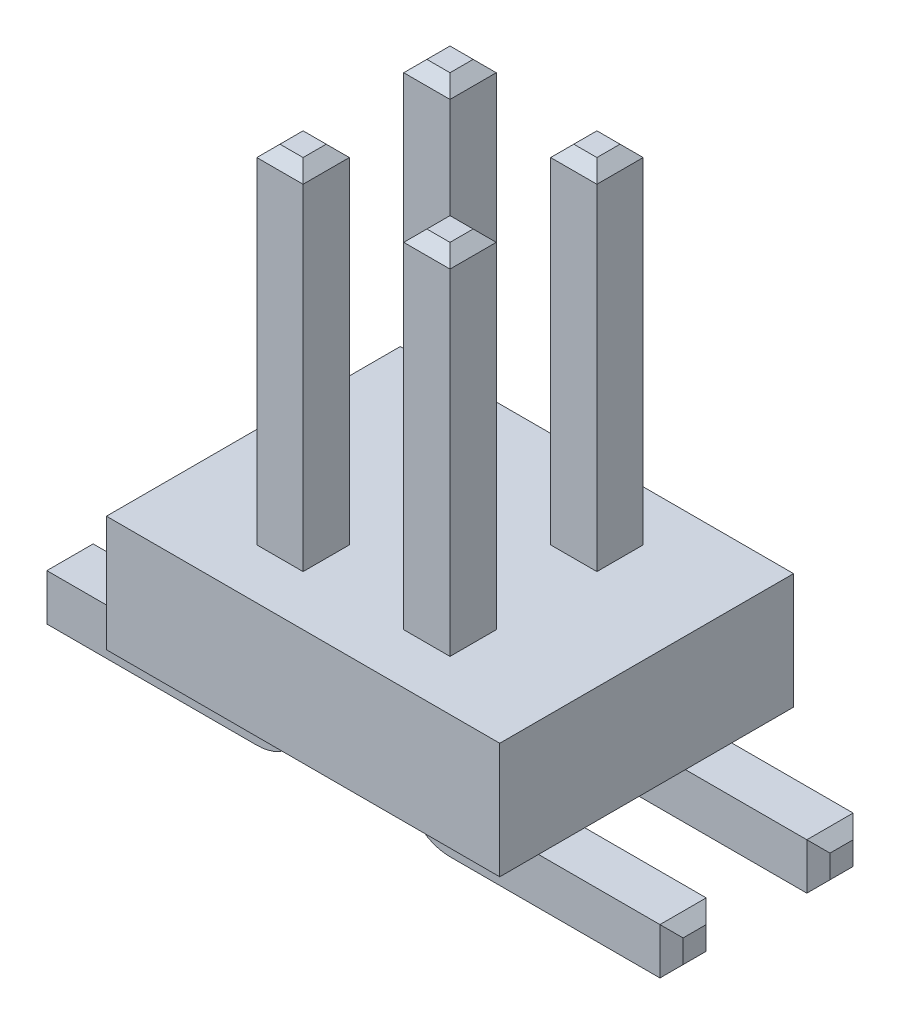
from build123d import *

# Parameters (mm, degrees)
SKIZZE1_W                       = 3.4
SKIZZE1_H                       = 1
AUFSATZ_LINEAR_AUSTRAGEN1_DEPTH = 2.54
SKIZZE3_W                       = 0.4
SKIZZE3_H                       = 0.4
AUFSATZ_LINEAR_AUSTRAGEN3_DEPTH = 0.5
SKIZZE4_W                       = 0.4
SKIZZE4_H                       = 0.4
AUFSATZ_LINEAR_AUSTRAGEN4_DEPTH = 1.915
SKIZZE5_W                       = 0.4
SKIZZE5_H                       = 0.4
AUFSATZ_LINEAR_AUSTRAGEN5_DEPTH = 1.915
SKIZZE6_W                       = 0.4
SKIZZE6_H                       = 0.4
AUFSATZ_LINEAR_AUSTRAGEN6_DEPTH = 3
FASE2_SIZE                      = 0.1
VERRUNDUNG1_R                   = 0.1
VERRUNDUNG2_R                   = 0.4


with BuildPart() as part:
    # Skizze1 → Aufsatz-Linear austragen1 (new body)
    with BuildSketch(Plane.XY):
        with Locations((1.7, 0.5)):
            Rectangle(SKIZZE1_W, SKIZZE1_H)
    extrude(amount=AUFSATZ_LINEAR_AUSTRAGEN1_DEPTH)

    # Skizze3 → Aufsatz-Linear austragen3 (add)
    with BuildSketch(Plane.XZ):
        with Locations((1.065, 1.905)):
            Rectangle(SKIZZE3_W, SKIZZE3_H)
        with Locations((2.335, 1.905)):
            Rectangle(SKIZZE3_W, SKIZZE3_H)
        with Locations((1.065, 0.635)):
            Rectangle(SKIZZE3_W, SKIZZE3_H)
        with Locations((2.335, 0.635)):
            Rectangle(SKIZZE3_W, SKIZZE3_H)
    extrude(amount=AUFSATZ_LINEAR_AUSTRAGEN3_DEPTH)

    # Skizze4 → Aufsatz-Linear austragen4 (add)
    with BuildSketch(Plane(origin=(2.535, 0, 0), x_dir=(0, 0, -1), z_dir=(1, 0, 0))):
        with Locations((-1.905, -0.3)):
            Rectangle(SKIZZE4_W, SKIZZE4_H)
        with Locations((-0.635, -0.3)):
            Rectangle(SKIZZE4_W, SKIZZE4_H)
    extrude(amount=AUFSATZ_LINEAR_AUSTRAGEN4_DEPTH)

    # Skizze5 → Aufsatz-Linear austragen5 (add)
    with BuildSketch(Plane.ZY.offset(-0.865)):
        with Locations((1.905, -0.3)):
            Rectangle(SKIZZE5_W, SKIZZE5_H)
        with Locations((0.635, -0.3)):
            Rectangle(SKIZZE5_W, SKIZZE5_H)
    extrude(amount=AUFSATZ_LINEAR_AUSTRAGEN5_DEPTH)

    # Skizze6 → Aufsatz-Linear austragen6 (add)
    with BuildSketch(Plane(origin=(0, 1, 0), x_dir=(1, 0, 0), z_dir=(0, 1, 0))):
        with Locations((1.065, -0.635)):
            Rectangle(SKIZZE6_W, SKIZZE6_H)
        with Locations((2.335, -0.635)):
            Rectangle(SKIZZE6_W, SKIZZE6_H)
        with Locations((1.065, -1.905)):
            Rectangle(SKIZZE6_W, SKIZZE6_H)
        with Locations((2.335, -1.905)):
            Rectangle(SKIZZE6_W, SKIZZE6_H)
    extrude(amount=AUFSATZ_LINEAR_AUSTRAGEN6_DEPTH)

    # Fase2
    fase2_edges = [part.edges().sort_by_distance(p)[0] for p in [
        (-1.05, -0.3, 0.435),
        (-1.05, -0.5, 0.635),
        (1.265, 4, 0.635),
        (1.065, 4, 0.435),
        (0.865, 4, 0.635),
        (1.065, 4, 0.835),
        (2.535, 4, 0.635),
        (2.335, 4, 0.435),
        (2.135, 4, 0.635),
        (2.335, 4, 0.835),
        (1.265, 4, 1.905),
        (1.065, 4, 1.705),
        (0.865, 4, 1.905),
        (1.065, 4, 2.105),
        (2.535, 4, 1.905),
        (2.335, 4, 1.705),
        (2.135, 4, 1.905),
        (2.335, 4, 2.105),
        (4.45, -0.3, 2.105),
        (4.45, -0.5, 1.905),
        (4.45, -0.3, 1.705),
        (4.45, -0.1, 1.905),
        (4.45, -0.3, 0.835),
        (4.45, -0.5, 0.635),
        (4.45, -0.3, 0.435),
        (4.45, -0.1, 0.635),
        (-1.05, -0.3, 2.105),
        (-1.05, -0.1, 1.905),
        (-1.05, -0.3, 1.705),
        (-1.05, -0.5, 1.905),
        (-1.05, -0.3, 0.835),
        (-1.05, -0.1, 0.635),
    ]]
    chamfer(fase2_edges, length=FASE2_SIZE)

    # Verrundung1
    verrundung1_edges = [part.edges().sort_by_distance(p)[0] for p in [
        (0.865, -0.1, 1.905),
        (0.865, -0.1, 0.635),
        (2.535, -0.1, 1.905),
        (2.535, -0.1, 0.635),
    ]]
    fillet(verrundung1_edges, radius=VERRUNDUNG1_R - 0.0001)  # a hair under: the kernel refuses the full size

    # Verrundung2
    verrundung2_edges = [part.edges().sort_by_distance(p)[0] for p in [
        (1.265, -0.5, 1.905),
        (2.135, -0.5, 1.905),
        (1.265, -0.5, 0.635),
        (2.135, -0.5, 0.635),
    ]]
    fillet(verrundung2_edges, radius=VERRUNDUNG2_R)


solid = part.part
